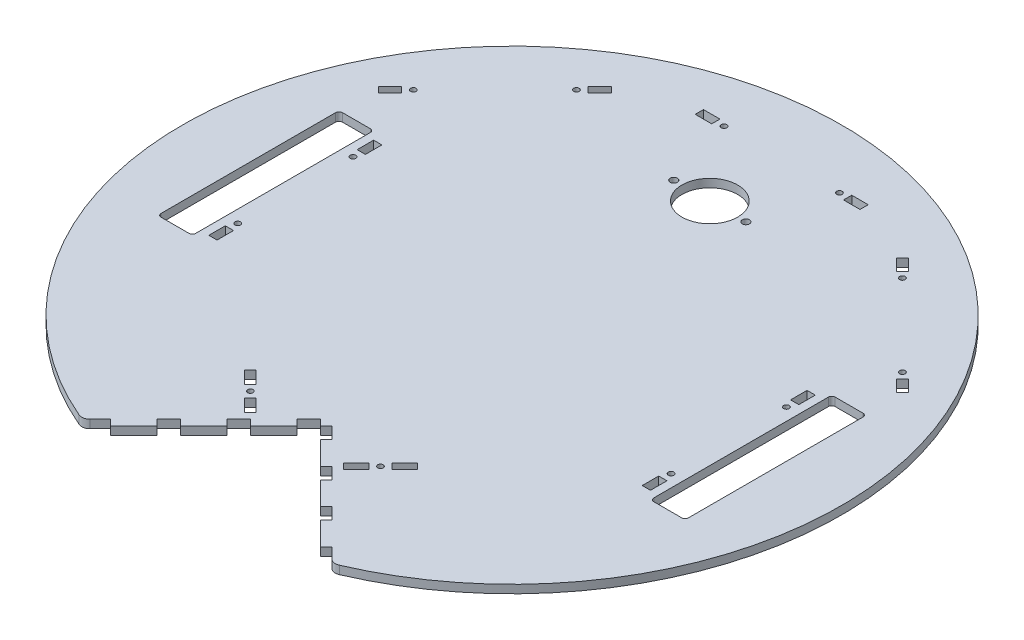
from build123d import *

# Parameters (mm, degrees)
SKETCH1_R           = 254
BOSS_EXTRUDE1_DEPTH = 6.35
CUT_EXTRUDE2_DEPTH  = 360.266367059
CUT_EXTRUDE4_DEPTH  = 360.266367059
SKETCH6_R           = 2.0955
CUT_EXTRUDE6_DEPTH  = 360.266367059
SKETCH8_R           = 2.1336
SKETCH8_W           = 6.35
SKETCH8_H           = 12.7
CUT_EXTRUDE7_DEPTH  = 360.266367059
SKETCH9_R           = 2.1336
SKETCH9_W           = 12.7
SKETCH9_H           = 6.35
CUT_EXTRUDE8_DEPTH  = 360.266367059
SKETCH10_R          = 2.1336
CUT_EXTRUDE9_DEPTH  = 360.266367059
SKETCH11_R          = 21.463
SKETCH11_R_2        = 2.778125
CUT_EXTRUDE10_DEPTH = 360.266367059
SKETCH12_W          = 25.4
SKETCH12_H          = 6.35
SKETCH12_W_2        = 12.7
CUT_EXTRUDE11_DEPTH = 6.35
FILLET1_R           = 6.35


with BuildPart() as part:
    # Sketch1 → Boss-Extrude1 (new body)
    with BuildSketch(Plane(origin=(0, 0, 0), x_dir=(1, 0, 0), z_dir=(0, 1, 0))):
        Circle(SKETCH1_R)
    extrude(amount=BOSS_EXTRUDE1_DEPTH)

    # Sketch2 → Cut-Extrude2 (cut, through all)
    with BuildSketch(Plane(origin=(0, 6.35, 0), x_dir=(1, 0, 0), z_dir=(0, 1, 0))):
        with BuildLine():
            Line((0, -147.792682849), (-89.802561211, -237.59524406))
            ThreePointArc((-89.802561211, -237.59524406), (0, -254), (89.802561211, -237.59524406))
            Line((89.802561211, -237.59524406), (0, -147.792682849))
        make_face()
    extrude(amount=-CUT_EXTRUDE2_DEPTH, mode=Mode.SUBTRACT)

    # Sketch4 → Cut-Extrude4 (cut, through all)
    with BuildSketch(Plane(origin=(0, 6.35, 0), x_dir=(1, 0, 0), z_dir=(0, 1, 0))):
        with BuildLine():
            Line((-200.66, 69.85), (-179.07, 69.85))
            ThreePointArc((-179.07, 69.85), (-177.273948776, 69.106051224), (-176.53, 67.31))
            Line((-176.53, 67.31), (-176.53, -67.31))
            ThreePointArc((-176.53, -67.31), (-177.273948776, -69.106051224), (-179.07, -69.85))
            Line((-179.07, -69.85), (-200.66, -69.85))
            ThreePointArc((-200.66, -69.85), (-202.456051224, -69.106051224), (-203.2, -67.31))
            Line((-203.2, -67.31), (-203.2, 67.31))
            ThreePointArc((-203.2, 67.31), (-202.456051224, 69.106051224), (-200.66, 69.85))
        make_face()
    cut_extrude4 = extrude(amount=-CUT_EXTRUDE4_DEPTH, mode=Mode.SUBTRACT)

    # Mirror2: Cut-Extrude4 across plane
    add(cut_extrude4.mirror(Plane(origin=(0, 0, 0), x_dir=(0, 0, 1), z_dir=(1, 0, 0))), mode=Mode.SUBTRACT)

    # Sketch6 → Cut-Extrude6 (cut, through all)
    with BuildSketch(Plane(origin=(0, 6.35, 0), x_dir=(1, 0, 0), z_dir=(0, 1, 0))):
        with Locations((-50.143144547, -151.531075029)):
            Circle(SKETCH6_R)
        Polygon((-52.388208577, -144.795882939), (-62.120200579, -135.063890937), (-66.610328639, -139.554018997), (-56.878336637, -149.286010999), align=None)
        Polygon((-43.407952456, -153.77613906), (-33.675960454, -163.508131061), (-38.166088515, -167.998259122), (-47.898080516, -158.26626712), align=None)
    cut_extrude6 = extrude(amount=-CUT_EXTRUDE6_DEPTH, mode=Mode.SUBTRACT)

    # Mirror5: Cut-Extrude6 across plane
    add(cut_extrude6.mirror(Plane(origin=(0, 0, 0), x_dir=(0, 0, 1), z_dir=(1, 0, 0))), mode=Mode.SUBTRACT)

    # Sketch8 → Cut-Extrude7 (cut, through all)
    with BuildSketch(Plane.XZ):
        with Locations((-167.005, -44.45)):
            Circle(SKETCH8_R)
        with Locations((-167.005, 44.45)):
            Circle(SKETCH8_R)
        with Locations((-167.005, -57.15)):
            Rectangle(SKETCH8_W, SKETCH8_H)
        with Locations((-167.005, 57.15)):
            Rectangle(SKETCH8_W, SKETCH8_H)
    cut_extrude7 = extrude(amount=-CUT_EXTRUDE7_DEPTH, mode=Mode.SUBTRACT)

    # Mirror6: Cut-Extrude7 across plane
    add(cut_extrude7.mirror(Plane(origin=(0, 0, 0), x_dir=(0, 0, 1), z_dir=(1, 0, 0))), mode=Mode.SUBTRACT)

    # Sketch9 → Cut-Extrude8 (cut, through all)
    with BuildSketch(Plane.XZ):
        with Locations((-44.45, -207.81727558)):
            Circle(SKETCH9_R)
        with Locations((44.45, -207.81727558)):
            Circle(SKETCH9_R)
        with Locations((-57.15, -207.81727558)):
            Rectangle(SKETCH9_W, SKETCH9_H)
        with Locations((57.15, -207.81727558)):
            Rectangle(SKETCH9_W, SKETCH9_H)
    extrude(amount=-CUT_EXTRUDE8_DEPTH, mode=Mode.SUBTRACT)

    # Sketch10 → Cut-Extrude9 (cut, through all)
    with BuildSketch(Plane.XZ):
        with Locations((-188.470279928, -112.368300127)):
            Circle(SKETCH10_R)
        with Locations((-125.608487081, -175.230092975)):
            Circle(SKETCH10_R)
        Polygon((-204.18572814, -101.142979976), (-195.205472019, -110.123236097), (-190.715343959, -105.633108037), (-199.69560008, -96.652851915), align=None)
        Polygon((-123.363423051, -181.965285066), (-114.38316693, -190.945541187), (-109.893038869, -186.455413126), (-118.87329499, -177.475157005), align=None)
    cut_extrude9 = extrude(amount=-CUT_EXTRUDE9_DEPTH, mode=Mode.SUBTRACT)

    # Mirror7: Cut-Extrude9 across plane
    add(cut_extrude9.mirror(Plane(origin=(0, 0, 0), x_dir=(0, 0, 1), z_dir=(1, 0, 0))), mode=Mode.SUBTRACT)

    # Sketch11 → Cut-Extrude10 (cut, through all)
    with BuildSketch(Plane(origin=(0, 6.35, 0), x_dir=(1, 0, 0), z_dir=(0, 1, 0))):
        with Locations((0, 152.4)):
            Circle(SKETCH11_R)
        with Locations((27.78125, 152.4)):
            Circle(SKETCH11_R_2)
        with Locations((-27.78125, 152.4)):
            Circle(SKETCH11_R_2)
    extrude(amount=-CUT_EXTRUDE10_DEPTH, mode=Mode.SUBTRACT)

    # Sketch12 → Cut-Extrude11 (cut)
    with BuildSketch(Plane(origin=(73.896341425, 0, 73.896341425), x_dir=(0.7071067811865489, 0, -0.7071067811865462), z_dir=(0.7071067811865462, 0, 0.7071067811865489))):
        with Locations((-231.505208253, 3.175)):
            Rectangle(SKETCH12_W, SKETCH12_H)
        with Locations((-187.055208253, 3.175)):
            Rectangle(SKETCH12_W_2, SKETCH12_H)
        with Locations((-148.955208253, 3.175)):
            Rectangle(SKETCH12_W_2, SKETCH12_H)
        with Locations((-110.855208253, 3.175)):
            Rectangle(SKETCH12_W_2, SKETCH12_H)
    cut_extrude11 = extrude(amount=-CUT_EXTRUDE11_DEPTH, mode=Mode.SUBTRACT)

    # Mirror8: Cut-Extrude11 across plane
    add(cut_extrude11.mirror(Plane(origin=(0, 0, 0), x_dir=(0, 0, 1), z_dir=(1, 0, 0))), mode=Mode.SUBTRACT)

    # Fillet1
    fillet1_edges = [part.edges().sort_by_distance(p)[0] for p in [
        (96.246367498, 3.175, 235.058794227),
        (-96.246367498, 3.175, 235.058794227),
    ]]
    fillet(fillet1_edges, radius=FILLET1_R)


solid = part.part
